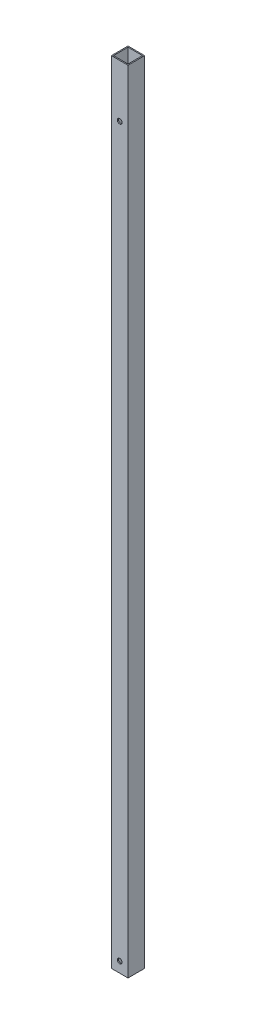
from build123d import *

# Parameters (mm, degrees)
SKETCH1_W           = 15.8
SKETCH1_H           = 15.8
SKETCH1_W_2         = 13.8
SKETCH1_H_2         = 13.8
BOSS_EXTRUDE1_DEPTH = 750
SKETCH3_R           = 2.25
CUT_EXTRUDE1_DEPTH  = 751.208004489


with BuildPart() as part:
    # Sketch1 → Boss-Extrude1 (new body)
    with BuildSketch(Plane(origin=(0, 0, 0), x_dir=(1, 0, 0), z_dir=(0, 1, 0))):
        Rectangle(SKETCH1_W, SKETCH1_H)
        Rectangle(SKETCH1_W_2, SKETCH1_H_2, mode=Mode.SUBTRACT)
    extrude(amount=BOSS_EXTRUDE1_DEPTH)

    # Sketch3 → Cut-Extrude1 (cut, through all)
    with BuildSketch(Plane.XY.offset(7.9)):
        with Locations((0, 10)):
            Circle(SKETCH3_R)
        with Locations((0, 700)):
            Circle(SKETCH3_R)
    extrude(amount=-CUT_EXTRUDE1_DEPTH, mode=Mode.SUBTRACT)


solid = part.part
